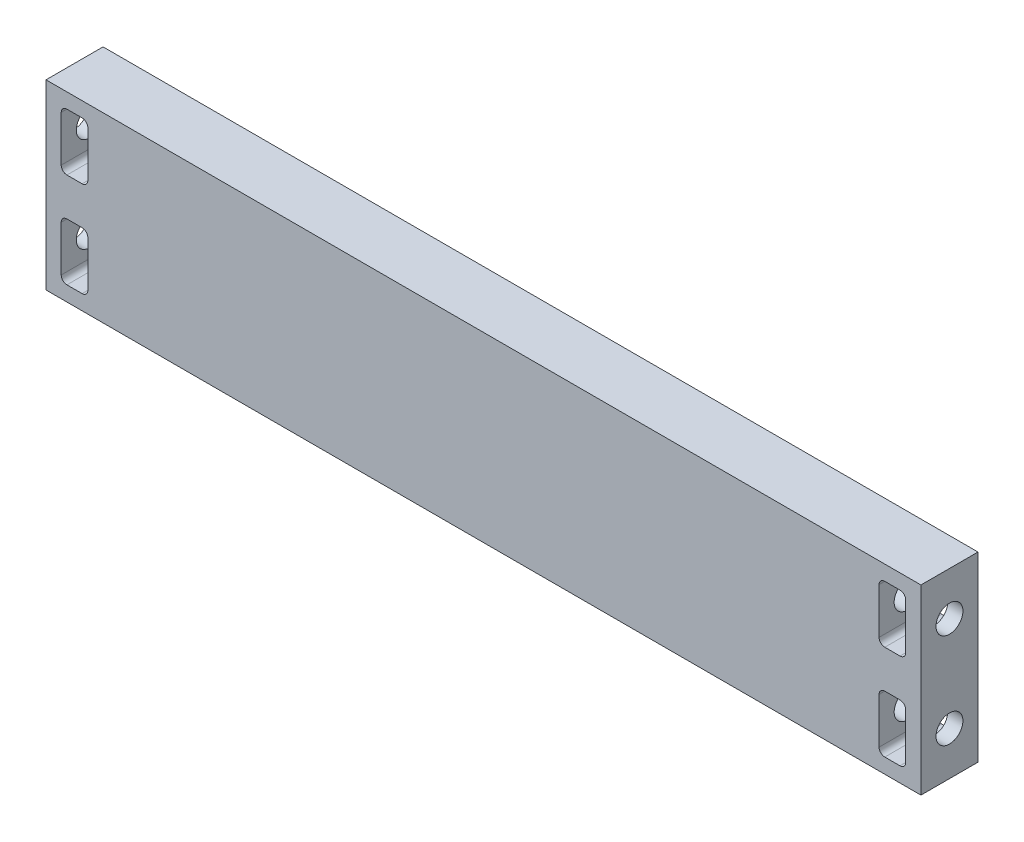
from build123d import *

# Parameters (mm, degrees)
SKETCH1_W                                  = 146.05
SKETCH1_H                                  = 30.38579648
BOSS_EXTRUDE1_DEPTH                        = 9.525
SKETCH2_R                                  = 2.2479
CUT_EXTRUDE1_DEPTH                         = 10.795
MIRROR1_AT_THE_SECOND_PLANE_COPY_1_SKETC_R = 2.2479
MIRROR1_AT_THE_SECOND_PLANE_COPY_1_DEPTH   = 10.795


with BuildPart() as part:
    # Sketch1 → Boss-Extrude1 (new body)
    with BuildSketch(Plane.XY):
        Rectangle(SKETCH1_W, SKETCH1_H)
        with BuildLine():
            Line((-69.5325, 12.7), (-66.9925, 12.7))
            ThreePointArc((-66.9925, 12.7), (-66.318980791, 12.421019209), (-66.04, 11.7475))
            Line((-66.04, 11.7475), (-66.04, 4.1275))
            ThreePointArc((-66.04, 4.1275), (-66.318980791, 3.453980791), (-66.9925, 3.175))
            Line((-66.9925, 3.175), (-69.5325, 3.175))
            ThreePointArc((-69.5325, 3.175), (-70.206019209, 3.453980791), (-70.485, 4.1275))
            Line((-70.485, 4.1275), (-70.485, 11.7475))
            ThreePointArc((-70.485, 11.7475), (-70.206019209, 12.421019209), (-69.5325, 12.7))
        make_face(mode=Mode.SUBTRACT)
        with BuildLine():
            Line((-66.04, -11.7475), (-66.04, -4.1275))
            ThreePointArc((-66.04, -4.1275), (-66.318980791, -3.453980791), (-66.9925, -3.175))
            Line((-66.9925, -3.175), (-69.5325, -3.175))
            ThreePointArc((-69.5325, -3.175), (-70.206019209, -3.453980791), (-70.485, -4.1275))
            Line((-70.485, -4.1275), (-70.485, -11.7475))
            ThreePointArc((-70.485, -11.7475), (-70.206019209, -12.421019209), (-69.5325, -12.7))
            Line((-69.5325, -12.7), (-66.9925, -12.7))
            ThreePointArc((-66.9925, -12.7), (-66.318980791, -12.421019209), (-66.04, -11.7475))
        make_face(mode=Mode.SUBTRACT)
        with BuildLine():
            Line((66.04, 11.7475), (66.04, 4.1275))
            ThreePointArc((66.04, 4.1275), (66.318980791, 3.453980791), (66.9925, 3.175))
            Line((66.9925, 3.175), (69.5325, 3.175))
            ThreePointArc((69.5325, 3.175), (70.206019209, 3.453980791), (70.485, 4.1275))
            Line((70.485, 4.1275), (70.485, 11.7475))
            ThreePointArc((70.485, 11.7475), (70.206019209, 12.421019209), (69.5325, 12.7))
            Line((69.5325, 12.7), (66.9925, 12.7))
            ThreePointArc((66.9925, 12.7), (66.318980791, 12.421019209), (66.04, 11.7475))
        make_face(mode=Mode.SUBTRACT)
        with BuildLine():
            Line((69.5325, -12.7), (66.9925, -12.7))
            ThreePointArc((66.9925, -12.7), (66.318980791, -12.421019209), (66.04, -11.7475))
            Line((66.04, -11.7475), (66.04, -4.1275))
            ThreePointArc((66.04, -4.1275), (66.318980791, -3.453980791), (66.9925, -3.175))
            Line((66.9925, -3.175), (69.5325, -3.175))
            ThreePointArc((69.5325, -3.175), (70.206019209, -3.453980791), (70.485, -4.1275))
            Line((70.485, -4.1275), (70.485, -11.7475))
            ThreePointArc((70.485, -11.7475), (70.206019209, -12.421019209), (69.5325, -12.7))
        make_face(mode=Mode.SUBTRACT)
    extrude(amount=BOSS_EXTRUDE1_DEPTH)

    # Sketch2 → Cut-Extrude1 (cut)
    with BuildSketch(Plane(origin=(73.025, 0, 0), x_dir=(0, 0, -1), z_dir=(1, 0, 0))):
        with Locations((-4.7625, 7.9375)):
            Circle(SKETCH2_R)
    cut_extrude1 = extrude(amount=-CUT_EXTRUDE1_DEPTH, mode=Mode.SUBTRACT)

    # Mirror1: Cut-Extrude1 across plane
    add(cut_extrude1.mirror(Plane(origin=(0, 0, 0), x_dir=(0, 0, 1), z_dir=(1, 0, 0))), mode=Mode.SUBTRACT)

    # Mirror1 at the second plane: Cut-Extrude1 across plane
    add(cut_extrude1.mirror(Plane.ZX), mode=Mode.SUBTRACT)

    # Mirror1 at the second plane copy 1 sketc → Mirror1 at the second plane copy 1 (cut)
    with BuildSketch(Plane(origin=(-73.025, 0, 0), x_dir=(0, 0, -1), z_dir=(-1, 0, 0))):
        with Locations((-4.7625, 7.9375)):
            Circle(MIRROR1_AT_THE_SECOND_PLANE_COPY_1_SKETC_R)
    extrude(amount=-MIRROR1_AT_THE_SECOND_PLANE_COPY_1_DEPTH, mode=Mode.SUBTRACT)


solid = part.part
